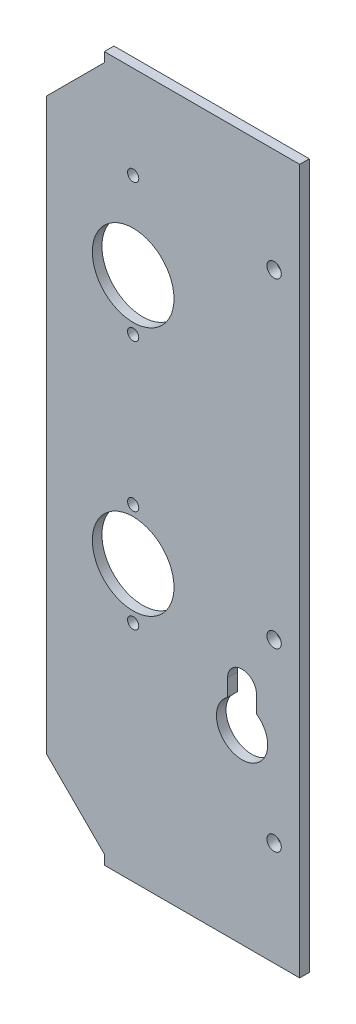
from build123d import *

# Parameters (mm, degrees)
BOSS_EXTRUDE1_DEPTH = 3
SKETCH2_R           = 12.75
CUT_EXTRUDE1_DEPTH  = 136.462171841
SKETCH3_R           = 1.75
CUT_EXTRUDE2_DEPTH  = 136.462171841
SKETCH4_R           = 2.25
CUT_EXTRUDE3_DEPTH  = 136.462171841
CUT_EXTRUDE4_DEPTH  = 136.462171841


with BuildPart() as part:
    # Sketch1 → Boss-Extrude1 (new body)
    with BuildSketch(Plane.XY):
        Polygon((0, 110), (0, -110), (-61, -110), (-61, -107), (-79, -89), (-79, 89), (-61, 107), (-61, 110), align=None)
    extrude(amount=-BOSS_EXTRUDE1_DEPTH)

    # Sketch2 → Cut-Extrude1 (cut, through all)
    with BuildSketch(Plane.XY):
        with Locations((-52, 54)):
            Circle(SKETCH2_R)
        with Locations((-52, -24)):
            Circle(SKETCH2_R)
    extrude(amount=-CUT_EXTRUDE1_DEPTH, mode=Mode.SUBTRACT)

    # Sketch3 → Cut-Extrude2 (cut, through all)
    with BuildSketch(Plane(origin=(0, 0, -3), x_dir=(-1, 0, 0), z_dir=(0, 0, -1))):
        with Locations((52, 81)):
            Circle(SKETCH3_R)
        with Locations((52, 38)):
            Circle(SKETCH3_R)
        with Locations((52, -40)):
            Circle(SKETCH3_R)
        with Locations((52, -8)):
            Circle(SKETCH3_R)
    extrude(amount=-CUT_EXTRUDE2_DEPTH, mode=Mode.SUBTRACT)

    # Sketch4 → Cut-Extrude3 (cut, through all)
    with BuildSketch(Plane.XY):
        with Locations((-8, 77.5)):
            Circle(SKETCH4_R)
        with Locations((-8, -77.5)):
            Circle(SKETCH4_R)
        with Locations((-8, -22.5)):
            Circle(SKETCH4_R)
    extrude(amount=-CUT_EXTRUDE3_DEPTH, mode=Mode.SUBTRACT)

    # Sketch5 → Cut-Extrude4 (cut, through all)
    with BuildSketch(Plane.XY):
        with BuildLine():
            Line((-22.5, -40), (-22.5, -45.385621722))
            ThreePointArc((-22.5, -45.385621722), (-18, -60), (-13.5, -45.385621722))
            Line((-13.5, -45.385621722), (-13.5, -40))
            ThreePointArc((-13.5, -40), (-18, -35.5), (-22.5, -40))
        make_face()
    extrude(amount=-CUT_EXTRUDE4_DEPTH, mode=Mode.SUBTRACT)


solid = part.part
